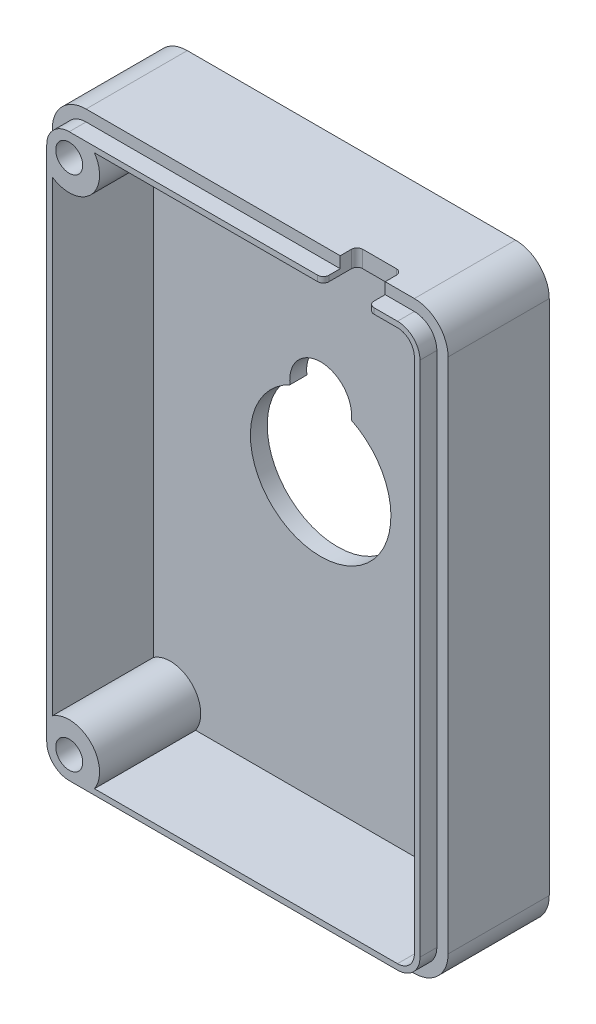
from build123d import *

# Parameters (mm, degrees)
EXRUDE_BASE_DEPTH       = 1.5
EXTRUDE_SIDEWALLS_DEPTH = 9
PARTLING_LINE_LIP_START = -1.5
PARTLING_LINE_LIP_DEPTH = 1.5
SKETCH4_W               = 1.5
SKETCH4_H               = 10
SKETCH4_W_2             = 2.151899305
BOSS_EXTRUDE3_DEPTH     = 1.5
FILLET2_R               = 0.25
CUT_EXTRUDE2_DEPTH      = 1.5
FILLET3_R               = 0.5
SCREWBOSS_DEPTH         = 9
SCREWHOLE_DEPTH         = 34.88613029
SCREWHOLE_DEPTH_BACK    = 34.88613029
SCREW_HOLES_R           = 1.2
SKETCH8_R               = 2.2
CUT_EXTRUDE4_DEPTH      = 2.6


with BuildPart() as part:
    # Sketch1 → Exrude-Base (new body)
    with BuildSketch(Plane.XY):
        with BuildLine():
            Line((9.739580757, 25.295602697), (12.739580757, 25.295602697))
            Line((12.739580757, 25.295602697), (13.239580757, 25.295602697))
            Line((13.239580757, 25.295602697), (13.739580757, 25.295602697))
            Line((13.739580757, 25.295602697), (15.834580757, 25.295602697))
            ThreePointArc((15.834580757, 25.295602697), (17.9559011, 24.41692304), (18.834580757, 22.295602697))
            Line((18.834580757, 22.295602697), (18.834580757, -23.693227454))
            ThreePointArc((18.834580757, -23.693227454), (17.9559011, -25.814547798), (15.834580757, -26.693227454))
            Line((15.834580757, -26.693227454), (-13.365419243, -26.693227454))
            ThreePointArc((-13.365419243, -26.693227454), (-15.486739587, -25.814547798), (-16.365419243, -23.693227454))
            Line((-16.365419243, -23.693227454), (-16.365419243, 22.295602697))
            ThreePointArc((-16.365419243, 22.295602697), (-15.486739587, 24.41692304), (-13.365419243, 25.295602697))
            Line((-13.365419243, 25.295602697), (8.739580757, 25.295602697))
            Line((8.739580757, 25.295602697), (9.239580757, 25.295602697))
            Line((9.239580757, 25.295602697), (9.739580757, 25.295602697))
        make_face()
        with BuildLine():
            ThreePointArc((-2.72431184, 5.625), (0, -6.25), (2.72431184, 5.625))
            ThreePointArc((2.72431184, 5.625), (0, 8.75), (-2.72431184, 5.625))
        make_face(mode=Mode.SUBTRACT)
    extrude(amount=EXRUDE_BASE_DEPTH)

    # Sketch2 → Extrude-Sidewalls (add)
    with BuildSketch(Plane.XY.offset(1.5)):
        with BuildLine():
            Line((18.834580757, 22.295602697), (18.834580757, -23.693227454))
            ThreePointArc((18.834580757, -23.693227454), (17.9559011, -25.814547798), (15.834580757, -26.693227454))
            Line((15.834580757, -26.693227454), (-13.365419243, -26.693227454))
            ThreePointArc((-13.365419243, -26.693227454), (-15.486739587, -25.814547798), (-16.365419243, -23.693227454))
            Line((-16.365419243, -23.693227454), (-16.365419243, 22.295602697))
            ThreePointArc((-16.365419243, 22.295602697), (-15.486739587, 24.41692304), (-13.365419243, 25.295602697))
            Line((-13.365419243, 25.295602697), (15.834580757, 25.295602697))
            ThreePointArc((15.834580757, 25.295602697), (17.9559011, 24.41692304), (18.834580757, 22.295602697))
        make_face()
        with BuildLine():
            Line((17.334580757, 22.295602697), (17.334580757, -23.693227454))
            ThreePointArc((17.334580757, -23.693227454), (16.895240929, -24.753887626), (15.834580757, -25.193227454))
            Line((15.834580757, -25.193227454), (-13.365419243, -25.193227454))
            ThreePointArc((-13.365419243, -25.193227454), (-14.426079415, -24.753887626), (-14.865419243, -23.693227454))
            Line((-14.865419243, -23.693227454), (-14.865419243, 22.295602697))
            ThreePointArc((-14.865419243, 22.295602697), (-14.426079415, 23.356262868), (-13.365419243, 23.795602697))
            Line((-13.365419243, 23.795602697), (15.834580757, 23.795602697))
            ThreePointArc((15.834580757, 23.795602697), (16.895240929, 23.356262868), (17.334580757, 22.295602697))
        make_face(mode=Mode.SUBTRACT)
    extrude(amount=EXTRUDE_SIDEWALLS_DEPTH)

    # Sketch3 → Partling-Line-Lip (cut)
    with BuildSketch(Plane.XY.offset(10.5).offset(PARTLING_LINE_LIP_START)):
        with BuildLine():
            Line((18.834580757, 22.295602697), (18.834580757, -23.693227454))
            ThreePointArc((18.834580757, -23.693227454), (17.9559011, -25.814547798), (15.834580757, -26.693227454))
            Line((15.834580757, -26.693227454), (-13.365419243, -26.693227454))
            ThreePointArc((-13.365419243, -26.693227454), (-15.486739587, -25.814547798), (-16.365419243, -23.693227454))
            Line((-16.365419243, -23.693227454), (-16.365419243, 22.295602697))
            ThreePointArc((-16.365419243, 22.295602697), (-15.486739587, 24.41692304), (-13.365419243, 25.295602697))
            Line((-13.365419243, 25.295602697), (15.834580757, 25.295602697))
            ThreePointArc((15.834580757, 25.295602697), (17.9559011, 24.41692304), (18.834580757, 22.295602697))
        make_face()
        with BuildLine():
            Line((17.834580757, 22.295602697), (17.834580757, -23.693227454))
            ThreePointArc((17.834580757, -23.693227454), (17.248794319, -25.107441017), (15.834580757, -25.693227454))
            Line((15.834580757, -25.693227454), (-13.365419243, -25.693227454))
            ThreePointArc((-13.365419243, -25.693227454), (-14.779632806, -25.107441017), (-15.365419243, -23.693227454))
            Line((-15.365419243, -23.693227454), (-15.365419243, 22.295602697))
            ThreePointArc((-15.365419243, 22.295602697), (-14.779632806, 23.709816259), (-13.365419243, 24.295602697))
            Line((-13.365419243, 24.295602697), (15.834580757, 24.295602697))
            ThreePointArc((15.834580757, 24.295602697), (17.248794319, 23.709816259), (17.834580757, 22.295602697))
        make_face(mode=Mode.SUBTRACT)
    extrude(amount=PARTLING_LINE_LIP_DEPTH, mode=Mode.SUBTRACT)

    # Sketch4 → Boss-Extrude3 (add)
    with BuildSketch(Plane.XY.offset(1.5)):
        with Locations((12.909580757, 18.795602697)):
            Rectangle(SKETCH4_W, SKETCH4_H)
        with Locations((16.73553041, 18.795602697)):
            Rectangle(SKETCH4_W_2, SKETCH4_H)
    extrude(amount=BOSS_EXTRUDE3_DEPTH)

    # Fillet2
    fillet2_edges = [part.edges().sort_by_distance(p)[0] for p in [
        (13.659580757, 18.795602697, 3),
        (12.159580757, 18.795602697, 3),
        (12.159580757, 13.795602697, 2.25),
        (16.497080757, 13.795602697, 3),
        (15.659580757, 18.795602697, 3),
        (12.909580757, 13.795602697, 3),
    ]]
    fillet(fillet2_edges, radius=FILLET2_R)
    fillet2_2_edges = [part.edges().sort_by_distance(p)[0] for p in [
        (13.659580757, 23.795602697, 2.125),
        (13.034580757, 13.795602697, 1.5),
        (17.334580757, 13.795602697, 2.125),
        (15.659580757, 23.795602697, 2.125),
        (12.909580757, 23.795602697, 3),
        (12.159580757, 23.795602697, 2.125),
        (12.159580757, 18.920602697, 1.5),
        (17.334580757, 18.170602697, 3),
        (16.921434013, 23.329406353, 3),
        (16.497080757, 13.795602697, 1.5),
        (15.871629396, 23.795145092, 2.997102598),
        (15.708024313, 23.795602697, 2.897901995),
        (17.334580757, 13.868826001, 2.926776695),
        (12.232804061, 13.868826001, 1.5),
        (12.232804061, 23.795602697, 2.926776695),
        (13.586357452, 23.795602697, 2.926776695),
    ]]
    fillet(fillet2_2_edges, radius=FILLET2_R)

    # Sketch5 → Cut-Extrude2 (cut)
    with BuildSketch(Plane(origin=(0, 25.295602697, 0), x_dir=(1, 0, 0), z_dir=(0, 1, 0))):
        with BuildLine():
            Line((9.239580757, -10.5), (9.239580757, -8))
            ThreePointArc((9.239580757, -8), (9.386027366, -7.646446609), (9.739580757, -7.5))
            Line((9.739580757, -7.5), (12.739580757, -7.5))
            ThreePointArc((12.739580757, -7.5), (13.093134147, -7.646446609), (13.239580757, -8))
            Line((13.239580757, -8), (13.239580757, -10.5))
            Line((13.239580757, -10.5), (9.239580757, -10.5))
        make_face()
    extrude(amount=-CUT_EXTRUDE2_DEPTH, mode=Mode.SUBTRACT)

    # Fillet3
    fillet3_edges = [part.edges().sort_by_distance(p)[0] for p in [
        (13.239580757, 24.045602697, 10.5),
        (9.239580757, 24.045602697, 10.5),
    ]]
    fillet(fillet3_edges, radius=FILLET3_R)

    # Sketch7 → ScrewBoss (add)
    with BuildSketch(Plane.XY.offset(1.5)):
        with BuildLine():
            Line((-13.365419243, -25.193227454), (-11.120424811, -25.193227454))
            ThreePointArc((-11.120424811, -25.193227454), (-11.456230934, -21.784039145), (-14.865419243, -21.448233022))
            Line((-14.865419243, -21.448233022), (-14.865419243, -23.693227454))
            ThreePointArc((-14.865419243, -23.693227454), (-14.426079415, -24.753887626), (-13.365419243, -25.193227454))
        make_face()
        with BuildLine():
            Line((-11.120424811, 23.795602697), (-13.365419243, 23.795602697))
            ThreePointArc((-13.365419243, 23.795602697), (-14.426079415, 23.356262868), (-14.865419243, 22.295602697))
            Line((-14.865419243, 22.295602697), (-14.865419243, 20.050608265))
            ThreePointArc((-14.865419243, 20.050608265), (-11.456230934, 20.386414387), (-11.120424811, 23.795602697))
        make_face()
    extrude(amount=SCREWBOSS_DEPTH)

    # Screw-Holes → ScrewHole (cut, two sides: drawn at the far end of the back side and taken through both)
    with BuildSketch(Plane.XY.offset(1.5).offset(-SCREWHOLE_DEPTH_BACK)):
        with Locations((-13.365419243, 22.295602697)):
            Circle(SCREW_HOLES_R)
        with Locations((-13.365419243, -23.693227454)):
            Circle(SCREW_HOLES_R)
    extrude(amount=SCREWHOLE_DEPTH + SCREWHOLE_DEPTH_BACK, mode=Mode.SUBTRACT)

    # Sketch8 → Cut-Extrude4 (cut)
    with BuildSketch(Plane(origin=(0, 0, 0), x_dir=(-1, 0, 0), z_dir=(0, 0, -1))):
        with Locations((13.365419243, 22.295602697)):
            Circle(SKETCH8_R)
        with Locations((13.365419243, -23.693227454)):
            Circle(SKETCH8_R)
    extrude(amount=-CUT_EXTRUDE4_DEPTH, mode=Mode.SUBTRACT)


solid = part.part
